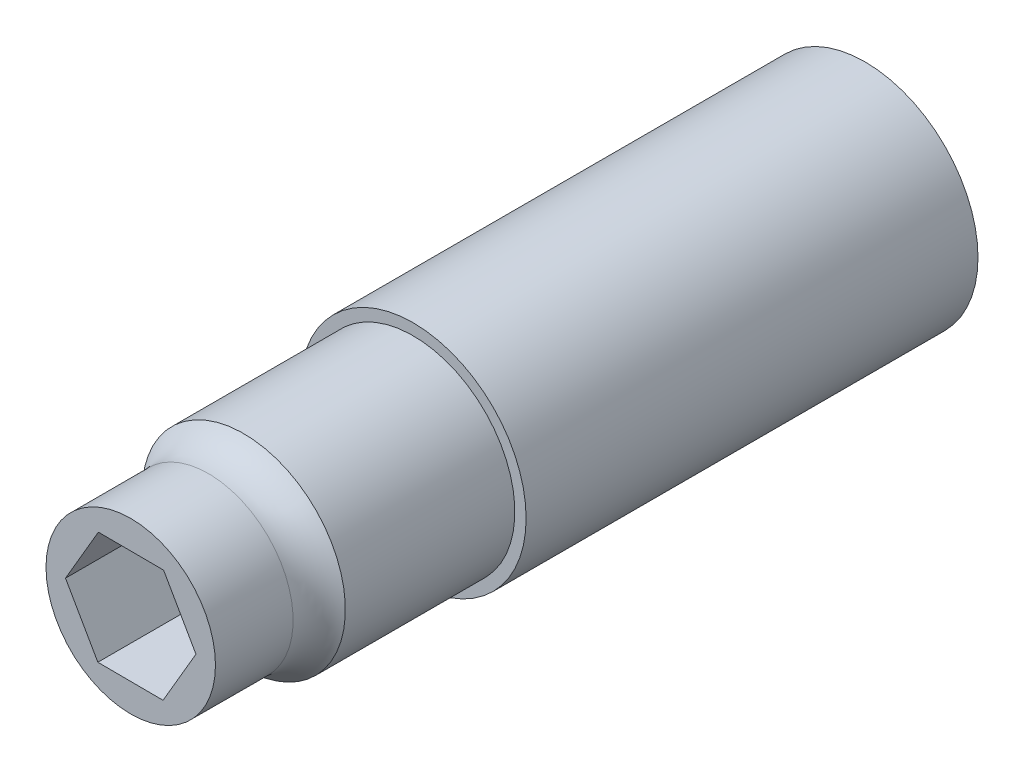
from build123d import *

# Parameters (mm, degrees)
SKETCH1_R           = 12.7
BOSS_EXTRUDE1_DEPTH = 50.8
SKETCH2_R           = 11.43
BOSS_EXTRUDE2_DEPTH = 19.05
SKETCH4_R           = 9.525
BOSS_EXTRUDE3_DEPTH = 12.7
FILLET1_R           = 5.08
CUT_EXTRUDE1_DEPTH  = 9.525


with BuildPart() as part:
    # Sketch1 → Boss-Extrude1 (new body)
    with BuildSketch(Plane.XY):
        Circle(SKETCH1_R)
    extrude(amount=BOSS_EXTRUDE1_DEPTH)

    # Sketch2 → Boss-Extrude2 (add)
    with BuildSketch(Plane.XY.offset(50.8)):
        with Locations(Location((0, 0, 0), (0, 0, 180))):
            Circle(SKETCH2_R)
    extrude(amount=BOSS_EXTRUDE2_DEPTH)

    # Sketch4 → Boss-Extrude3 (add)
    with BuildSketch(Plane.XY.offset(69.85)):
        Circle(SKETCH4_R)
    extrude(amount=BOSS_EXTRUDE3_DEPTH)

    # Fillet1
    # the kernel refuses this fillet: 5.08 mm, written as the material it adds along each edge
    with BuildSketch(Plane(origin=(0, 0, 69.85), x_dir=(1, 0, 0), z_dir=(0, -1, 0))) as fillet1_piece_1:
        with BuildLine():
            CenterArc((14.605, 3.965573729), FILLET1_R, 180, 51.317812547)
            Line((9.525, 3.965573729), (9.4234, 3.965573729))
            Line((9.4234, 3.965573729), (9.4234, 0))
            Line((9.4234, 0), (9.525, -0.1016))
            ThreePointArc((9.525, -0.1016), (10.4775, -0.1016), (11.3665, -0.079311475))
            Line((11.3665, -0.079311475), (11.43, 0))
        make_face()
    revolve(axis=Axis((0, 0, 69.85), (0, 0, 1)))

    # Sketch5 → Cut-Extrude1 (cut)
    with BuildSketch(Plane.XY.offset(82.55)):
        Polygon((3.698041146, 6.33149469), (-3.634214672, 6.368344922), (-7.332255819, 0.036850232), (-3.698041146, -6.33149469), (3.634214672, -6.368344922), (7.332255819, -0.036850232), align=None)
    extrude(amount=-CUT_EXTRUDE1_DEPTH, mode=Mode.SUBTRACT)


solid = part.part
